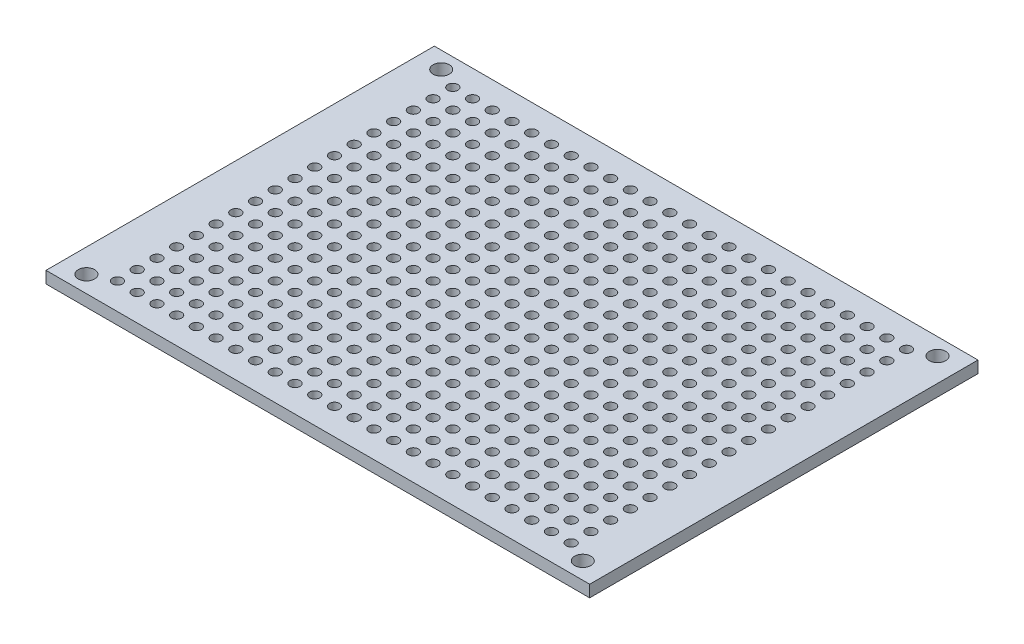
from build123d import *

# Parameters (mm, degrees)
SKETCH1_W                          = 70
SKETCH1_H                          = 50
BOSS_EXTRUDE1_DEPTH                = 0.762
F_1_3_START                        = -0.762
F_1_3_1_3_DIAMETER_HOLE1_OUTLINE_R = 0.65
F_1_3_1_3_DIAMETER_HOLE1_DEPTH     = 1.524
F_2_1_2_1_DIAMETER_HOLE1_D         = 2.1


# Read off the part's stored shape, not the designer's step: Ø1.3 (1.3) Diameter Hole1
with BuildPart() as part:
    # Sketch1 → Boss-Extrude1 (new, symmetric)
    with BuildSketch(Plane(origin=(0, 0, 0), x_dir=(1, 0, 0), z_dir=(0, 1, 0))):
        with Locations((35, 25)):
            Rectangle(SKETCH1_W, SKETCH1_H)
    extrude(amount=BOSS_EXTRUDE1_DEPTH, both=True)

    # Ø1.3 (1.3) Diameter Hole1 outline → Ø1.3 (1.3) Diameter Hole1 (cut)
    with BuildSketch(Plane(origin=(0, 0, 0), x_dir=(1, 0, 0), z_dir=(0, 1, 0)).offset(F_1_3_START)):
        with Locations((5.79, 46.59)):
            Circle(F_1_3_1_3_DIAMETER_HOLE1_OUTLINE_R)
        with Locations((5.79, 44.05)):
            Circle(F_1_3_1_3_DIAMETER_HOLE1_OUTLINE_R)
        with Locations((5.79, 41.51)):
            Circle(F_1_3_1_3_DIAMETER_HOLE1_OUTLINE_R)
        with Locations((5.79, 38.97)):
            Circle(F_1_3_1_3_DIAMETER_HOLE1_OUTLINE_R)
        with Locations((5.79, 36.43)):
            Circle(F_1_3_1_3_DIAMETER_HOLE1_OUTLINE_R)
        with Locations((5.79, 33.89)):
            Circle(F_1_3_1_3_DIAMETER_HOLE1_OUTLINE_R)
        with Locations((5.79, 31.35)):
            Circle(F_1_3_1_3_DIAMETER_HOLE1_OUTLINE_R)
        with Locations((5.79, 28.81)):
            Circle(F_1_3_1_3_DIAMETER_HOLE1_OUTLINE_R)
        with Locations((5.79, 26.27)):
            Circle(F_1_3_1_3_DIAMETER_HOLE1_OUTLINE_R)
        with Locations((5.79, 23.73)):
            Circle(F_1_3_1_3_DIAMETER_HOLE1_OUTLINE_R)
        with Locations((5.79, 21.19)):
            Circle(F_1_3_1_3_DIAMETER_HOLE1_OUTLINE_R)
        with Locations((5.79, 18.65)):
            Circle(F_1_3_1_3_DIAMETER_HOLE1_OUTLINE_R)
        with Locations((5.79, 16.11)):
            Circle(F_1_3_1_3_DIAMETER_HOLE1_OUTLINE_R)
        with Locations((5.79, 13.57)):
            Circle(F_1_3_1_3_DIAMETER_HOLE1_OUTLINE_R)
        with Locations((5.79, 11.03)):
            Circle(F_1_3_1_3_DIAMETER_HOLE1_OUTLINE_R)
        with Locations((5.79, 8.49)):
            Circle(F_1_3_1_3_DIAMETER_HOLE1_OUTLINE_R)
        with Locations((5.79, 5.95)):
            Circle(F_1_3_1_3_DIAMETER_HOLE1_OUTLINE_R)
        with Locations((64.21, 46.59)):
            Circle(F_1_3_1_3_DIAMETER_HOLE1_OUTLINE_R)
        with Locations((61.67, 46.59)):
            Circle(F_1_3_1_3_DIAMETER_HOLE1_OUTLINE_R)
        with Locations((59.13, 46.59)):
            Circle(F_1_3_1_3_DIAMETER_HOLE1_OUTLINE_R)
        with Locations((56.59, 46.59)):
            Circle(F_1_3_1_3_DIAMETER_HOLE1_OUTLINE_R)
        with Locations((54.05, 46.59)):
            Circle(F_1_3_1_3_DIAMETER_HOLE1_OUTLINE_R)
        with Locations((51.51, 46.59)):
            Circle(F_1_3_1_3_DIAMETER_HOLE1_OUTLINE_R)
        with Locations((48.97, 46.59)):
            Circle(F_1_3_1_3_DIAMETER_HOLE1_OUTLINE_R)
        with Locations((46.43, 46.59)):
            Circle(F_1_3_1_3_DIAMETER_HOLE1_OUTLINE_R)
        with Locations((43.89, 46.59)):
            Circle(F_1_3_1_3_DIAMETER_HOLE1_OUTLINE_R)
        with Locations((41.35, 46.59)):
            Circle(F_1_3_1_3_DIAMETER_HOLE1_OUTLINE_R)
        with Locations((38.81, 46.59)):
            Circle(F_1_3_1_3_DIAMETER_HOLE1_OUTLINE_R)
        with Locations((36.27, 46.59)):
            Circle(F_1_3_1_3_DIAMETER_HOLE1_OUTLINE_R)
        with Locations((33.73, 46.59)):
            Circle(F_1_3_1_3_DIAMETER_HOLE1_OUTLINE_R)
        with Locations((31.19, 46.59)):
            Circle(F_1_3_1_3_DIAMETER_HOLE1_OUTLINE_R)
        with Locations((28.65, 46.59)):
            Circle(F_1_3_1_3_DIAMETER_HOLE1_OUTLINE_R)
        with Locations((26.11, 46.59)):
            Circle(F_1_3_1_3_DIAMETER_HOLE1_OUTLINE_R)
        with Locations((23.57, 46.59)):
            Circle(F_1_3_1_3_DIAMETER_HOLE1_OUTLINE_R)
        with Locations((21.03, 46.59)):
            Circle(F_1_3_1_3_DIAMETER_HOLE1_OUTLINE_R)
        with Locations((18.49, 46.59)):
            Circle(F_1_3_1_3_DIAMETER_HOLE1_OUTLINE_R)
        with Locations((15.95, 46.59)):
            Circle(F_1_3_1_3_DIAMETER_HOLE1_OUTLINE_R)
        with Locations((13.41, 46.59)):
            Circle(F_1_3_1_3_DIAMETER_HOLE1_OUTLINE_R)
        with Locations((10.87, 46.59)):
            Circle(F_1_3_1_3_DIAMETER_HOLE1_OUTLINE_R)
        with Locations((8.33, 46.59)):
            Circle(F_1_3_1_3_DIAMETER_HOLE1_OUTLINE_R)
        with Locations((64.21, 44.05)):
            Circle(F_1_3_1_3_DIAMETER_HOLE1_OUTLINE_R)
        with Locations((61.67, 44.05)):
            Circle(F_1_3_1_3_DIAMETER_HOLE1_OUTLINE_R)
        with Locations((59.13, 44.05)):
            Circle(F_1_3_1_3_DIAMETER_HOLE1_OUTLINE_R)
        with Locations((56.59, 44.05)):
            Circle(F_1_3_1_3_DIAMETER_HOLE1_OUTLINE_R)
        with Locations((54.05, 44.05)):
            Circle(F_1_3_1_3_DIAMETER_HOLE1_OUTLINE_R)
        with Locations((51.51, 44.05)):
            Circle(F_1_3_1_3_DIAMETER_HOLE1_OUTLINE_R)
        with Locations((48.97, 44.05)):
            Circle(F_1_3_1_3_DIAMETER_HOLE1_OUTLINE_R)
        with Locations((46.43, 44.05)):
            Circle(F_1_3_1_3_DIAMETER_HOLE1_OUTLINE_R)
        with Locations((43.89, 44.05)):
            Circle(F_1_3_1_3_DIAMETER_HOLE1_OUTLINE_R)
        with Locations((41.35, 44.05)):
            Circle(F_1_3_1_3_DIAMETER_HOLE1_OUTLINE_R)
        with Locations((38.81, 44.05)):
            Circle(F_1_3_1_3_DIAMETER_HOLE1_OUTLINE_R)
        with Locations((36.27, 44.05)):
            Circle(F_1_3_1_3_DIAMETER_HOLE1_OUTLINE_R)
        with Locations((33.73, 44.05)):
            Circle(F_1_3_1_3_DIAMETER_HOLE1_OUTLINE_R)
        with Locations((31.19, 44.05)):
            Circle(F_1_3_1_3_DIAMETER_HOLE1_OUTLINE_R)
        with Locations((28.65, 44.05)):
            Circle(F_1_3_1_3_DIAMETER_HOLE1_OUTLINE_R)
        with Locations((26.11, 44.05)):
            Circle(F_1_3_1_3_DIAMETER_HOLE1_OUTLINE_R)
        with Locations((23.57, 44.05)):
            Circle(F_1_3_1_3_DIAMETER_HOLE1_OUTLINE_R)
        with Locations((21.03, 44.05)):
            Circle(F_1_3_1_3_DIAMETER_HOLE1_OUTLINE_R)
        with Locations((18.49, 44.05)):
            Circle(F_1_3_1_3_DIAMETER_HOLE1_OUTLINE_R)
        with Locations((15.95, 44.05)):
            Circle(F_1_3_1_3_DIAMETER_HOLE1_OUTLINE_R)
        with Locations((13.41, 44.05)):
            Circle(F_1_3_1_3_DIAMETER_HOLE1_OUTLINE_R)
        with Locations((10.87, 44.05)):
            Circle(F_1_3_1_3_DIAMETER_HOLE1_OUTLINE_R)
        with Locations((8.33, 44.05)):
            Circle(F_1_3_1_3_DIAMETER_HOLE1_OUTLINE_R)
        with Locations((64.21, 41.51)):
            Circle(F_1_3_1_3_DIAMETER_HOLE1_OUTLINE_R)
        with Locations((61.67, 41.51)):
            Circle(F_1_3_1_3_DIAMETER_HOLE1_OUTLINE_R)
        with Locations((59.13, 41.51)):
            Circle(F_1_3_1_3_DIAMETER_HOLE1_OUTLINE_R)
        with Locations((56.59, 41.51)):
            Circle(F_1_3_1_3_DIAMETER_HOLE1_OUTLINE_R)
        with Locations((54.05, 41.51)):
            Circle(F_1_3_1_3_DIAMETER_HOLE1_OUTLINE_R)
        with Locations((51.51, 41.51)):
            Circle(F_1_3_1_3_DIAMETER_HOLE1_OUTLINE_R)
        with Locations((48.97, 41.51)):
            Circle(F_1_3_1_3_DIAMETER_HOLE1_OUTLINE_R)
        with Locations((46.43, 41.51)):
            Circle(F_1_3_1_3_DIAMETER_HOLE1_OUTLINE_R)
        with Locations((43.89, 41.51)):
            Circle(F_1_3_1_3_DIAMETER_HOLE1_OUTLINE_R)
        with Locations((41.35, 41.51)):
            Circle(F_1_3_1_3_DIAMETER_HOLE1_OUTLINE_R)
        with Locations((38.81, 41.51)):
            Circle(F_1_3_1_3_DIAMETER_HOLE1_OUTLINE_R)
        with Locations((36.27, 41.51)):
            Circle(F_1_3_1_3_DIAMETER_HOLE1_OUTLINE_R)
        with Locations((33.73, 41.51)):
            Circle(F_1_3_1_3_DIAMETER_HOLE1_OUTLINE_R)
        with Locations((31.19, 41.51)):
            Circle(F_1_3_1_3_DIAMETER_HOLE1_OUTLINE_R)
        with Locations((28.65, 41.51)):
            Circle(F_1_3_1_3_DIAMETER_HOLE1_OUTLINE_R)
        with Locations((26.11, 41.51)):
            Circle(F_1_3_1_3_DIAMETER_HOLE1_OUTLINE_R)
        with Locations((23.57, 41.51)):
            Circle(F_1_3_1_3_DIAMETER_HOLE1_OUTLINE_R)
        with Locations((21.03, 41.51)):
            Circle(F_1_3_1_3_DIAMETER_HOLE1_OUTLINE_R)
        with Locations((18.49, 41.51)):
            Circle(F_1_3_1_3_DIAMETER_HOLE1_OUTLINE_R)
        with Locations((15.95, 41.51)):
            Circle(F_1_3_1_3_DIAMETER_HOLE1_OUTLINE_R)
        with Locations((13.41, 41.51)):
            Circle(F_1_3_1_3_DIAMETER_HOLE1_OUTLINE_R)
        with Locations((10.87, 41.51)):
            Circle(F_1_3_1_3_DIAMETER_HOLE1_OUTLINE_R)
        with Locations((8.33, 41.51)):
            Circle(F_1_3_1_3_DIAMETER_HOLE1_OUTLINE_R)
        with Locations((64.21, 38.97)):
            Circle(F_1_3_1_3_DIAMETER_HOLE1_OUTLINE_R)
        with Locations((61.67, 38.97)):
            Circle(F_1_3_1_3_DIAMETER_HOLE1_OUTLINE_R)
        with Locations((59.13, 38.97)):
            Circle(F_1_3_1_3_DIAMETER_HOLE1_OUTLINE_R)
        with Locations((56.59, 38.97)):
            Circle(F_1_3_1_3_DIAMETER_HOLE1_OUTLINE_R)
        with Locations((54.05, 38.97)):
            Circle(F_1_3_1_3_DIAMETER_HOLE1_OUTLINE_R)
        with Locations((51.51, 38.97)):
            Circle(F_1_3_1_3_DIAMETER_HOLE1_OUTLINE_R)
        with Locations((48.97, 38.97)):
            Circle(F_1_3_1_3_DIAMETER_HOLE1_OUTLINE_R)
        with Locations((46.43, 38.97)):
            Circle(F_1_3_1_3_DIAMETER_HOLE1_OUTLINE_R)
        with Locations((43.89, 38.97)):
            Circle(F_1_3_1_3_DIAMETER_HOLE1_OUTLINE_R)
        with Locations((41.35, 38.97)):
            Circle(F_1_3_1_3_DIAMETER_HOLE1_OUTLINE_R)
        with Locations((38.81, 38.97)):
            Circle(F_1_3_1_3_DIAMETER_HOLE1_OUTLINE_R)
        with Locations((36.27, 38.97)):
            Circle(F_1_3_1_3_DIAMETER_HOLE1_OUTLINE_R)
        with Locations((33.73, 38.97)):
            Circle(F_1_3_1_3_DIAMETER_HOLE1_OUTLINE_R)
        with Locations((31.19, 38.97)):
            Circle(F_1_3_1_3_DIAMETER_HOLE1_OUTLINE_R)
        with Locations((28.65, 38.97)):
            Circle(F_1_3_1_3_DIAMETER_HOLE1_OUTLINE_R)
        with Locations((26.11, 38.97)):
            Circle(F_1_3_1_3_DIAMETER_HOLE1_OUTLINE_R)
        with Locations((23.57, 38.97)):
            Circle(F_1_3_1_3_DIAMETER_HOLE1_OUTLINE_R)
        with Locations((21.03, 38.97)):
            Circle(F_1_3_1_3_DIAMETER_HOLE1_OUTLINE_R)
        with Locations((18.49, 38.97)):
            Circle(F_1_3_1_3_DIAMETER_HOLE1_OUTLINE_R)
        with Locations((15.95, 38.97)):
            Circle(F_1_3_1_3_DIAMETER_HOLE1_OUTLINE_R)
        with Locations((13.41, 38.97)):
            Circle(F_1_3_1_3_DIAMETER_HOLE1_OUTLINE_R)
        with Locations((10.87, 38.97)):
            Circle(F_1_3_1_3_DIAMETER_HOLE1_OUTLINE_R)
        with Locations((8.33, 38.97)):
            Circle(F_1_3_1_3_DIAMETER_HOLE1_OUTLINE_R)
        with Locations((64.21, 36.43)):
            Circle(F_1_3_1_3_DIAMETER_HOLE1_OUTLINE_R)
        with Locations((61.67, 36.43)):
            Circle(F_1_3_1_3_DIAMETER_HOLE1_OUTLINE_R)
        with Locations((59.13, 36.43)):
            Circle(F_1_3_1_3_DIAMETER_HOLE1_OUTLINE_R)
        with Locations((56.59, 36.43)):
            Circle(F_1_3_1_3_DIAMETER_HOLE1_OUTLINE_R)
        with Locations((54.05, 36.43)):
            Circle(F_1_3_1_3_DIAMETER_HOLE1_OUTLINE_R)
        with Locations((51.51, 36.43)):
            Circle(F_1_3_1_3_DIAMETER_HOLE1_OUTLINE_R)
        with Locations((48.97, 36.43)):
            Circle(F_1_3_1_3_DIAMETER_HOLE1_OUTLINE_R)
        with Locations((46.43, 36.43)):
            Circle(F_1_3_1_3_DIAMETER_HOLE1_OUTLINE_R)
        with Locations((43.89, 36.43)):
            Circle(F_1_3_1_3_DIAMETER_HOLE1_OUTLINE_R)
        with Locations((41.35, 36.43)):
            Circle(F_1_3_1_3_DIAMETER_HOLE1_OUTLINE_R)
        with Locations((38.81, 36.43)):
            Circle(F_1_3_1_3_DIAMETER_HOLE1_OUTLINE_R)
        with Locations((36.27, 36.43)):
            Circle(F_1_3_1_3_DIAMETER_HOLE1_OUTLINE_R)
        with Locations((33.73, 36.43)):
            Circle(F_1_3_1_3_DIAMETER_HOLE1_OUTLINE_R)
        with Locations((31.19, 36.43)):
            Circle(F_1_3_1_3_DIAMETER_HOLE1_OUTLINE_R)
        with Locations((28.65, 36.43)):
            Circle(F_1_3_1_3_DIAMETER_HOLE1_OUTLINE_R)
        with Locations((26.11, 36.43)):
            Circle(F_1_3_1_3_DIAMETER_HOLE1_OUTLINE_R)
        with Locations((23.57, 36.43)):
            Circle(F_1_3_1_3_DIAMETER_HOLE1_OUTLINE_R)
        with Locations((21.03, 36.43)):
            Circle(F_1_3_1_3_DIAMETER_HOLE1_OUTLINE_R)
        with Locations((18.49, 36.43)):
            Circle(F_1_3_1_3_DIAMETER_HOLE1_OUTLINE_R)
        with Locations((15.95, 36.43)):
            Circle(F_1_3_1_3_DIAMETER_HOLE1_OUTLINE_R)
        with Locations((13.41, 36.43)):
            Circle(F_1_3_1_3_DIAMETER_HOLE1_OUTLINE_R)
        with Locations((10.87, 36.43)):
            Circle(F_1_3_1_3_DIAMETER_HOLE1_OUTLINE_R)
        with Locations((8.33, 36.43)):
            Circle(F_1_3_1_3_DIAMETER_HOLE1_OUTLINE_R)
        with Locations((64.21, 33.89)):
            Circle(F_1_3_1_3_DIAMETER_HOLE1_OUTLINE_R)
        with Locations((61.67, 33.89)):
            Circle(F_1_3_1_3_DIAMETER_HOLE1_OUTLINE_R)
        with Locations((59.13, 33.89)):
            Circle(F_1_3_1_3_DIAMETER_HOLE1_OUTLINE_R)
        with Locations((56.59, 33.89)):
            Circle(F_1_3_1_3_DIAMETER_HOLE1_OUTLINE_R)
        with Locations((54.05, 33.89)):
            Circle(F_1_3_1_3_DIAMETER_HOLE1_OUTLINE_R)
        with Locations((51.51, 33.89)):
            Circle(F_1_3_1_3_DIAMETER_HOLE1_OUTLINE_R)
        with Locations((48.97, 33.89)):
            Circle(F_1_3_1_3_DIAMETER_HOLE1_OUTLINE_R)
        with Locations((46.43, 33.89)):
            Circle(F_1_3_1_3_DIAMETER_HOLE1_OUTLINE_R)
        with Locations((43.89, 33.89)):
            Circle(F_1_3_1_3_DIAMETER_HOLE1_OUTLINE_R)
        with Locations((41.35, 33.89)):
            Circle(F_1_3_1_3_DIAMETER_HOLE1_OUTLINE_R)
        with Locations((38.81, 33.89)):
            Circle(F_1_3_1_3_DIAMETER_HOLE1_OUTLINE_R)
        with Locations((36.27, 33.89)):
            Circle(F_1_3_1_3_DIAMETER_HOLE1_OUTLINE_R)
        with Locations((33.73, 33.89)):
            Circle(F_1_3_1_3_DIAMETER_HOLE1_OUTLINE_R)
        with Locations((31.19, 33.89)):
            Circle(F_1_3_1_3_DIAMETER_HOLE1_OUTLINE_R)
        with Locations((28.65, 33.89)):
            Circle(F_1_3_1_3_DIAMETER_HOLE1_OUTLINE_R)
        with Locations((26.11, 33.89)):
            Circle(F_1_3_1_3_DIAMETER_HOLE1_OUTLINE_R)
        with Locations((23.57, 33.89)):
            Circle(F_1_3_1_3_DIAMETER_HOLE1_OUTLINE_R)
        with Locations((21.03, 33.89)):
            Circle(F_1_3_1_3_DIAMETER_HOLE1_OUTLINE_R)
        with Locations((18.49, 33.89)):
            Circle(F_1_3_1_3_DIAMETER_HOLE1_OUTLINE_R)
        with Locations((15.95, 33.89)):
            Circle(F_1_3_1_3_DIAMETER_HOLE1_OUTLINE_R)
        with Locations((13.41, 33.89)):
            Circle(F_1_3_1_3_DIAMETER_HOLE1_OUTLINE_R)
        with Locations((10.87, 33.89)):
            Circle(F_1_3_1_3_DIAMETER_HOLE1_OUTLINE_R)
        with Locations((8.33, 33.89)):
            Circle(F_1_3_1_3_DIAMETER_HOLE1_OUTLINE_R)
        with Locations((64.21, 31.35)):
            Circle(F_1_3_1_3_DIAMETER_HOLE1_OUTLINE_R)
        with Locations((61.67, 31.35)):
            Circle(F_1_3_1_3_DIAMETER_HOLE1_OUTLINE_R)
        with Locations((59.13, 31.35)):
            Circle(F_1_3_1_3_DIAMETER_HOLE1_OUTLINE_R)
        with Locations((56.59, 31.35)):
            Circle(F_1_3_1_3_DIAMETER_HOLE1_OUTLINE_R)
        with Locations((54.05, 31.35)):
            Circle(F_1_3_1_3_DIAMETER_HOLE1_OUTLINE_R)
        with Locations((51.51, 31.35)):
            Circle(F_1_3_1_3_DIAMETER_HOLE1_OUTLINE_R)
        with Locations((48.97, 31.35)):
            Circle(F_1_3_1_3_DIAMETER_HOLE1_OUTLINE_R)
        with Locations((46.43, 31.35)):
            Circle(F_1_3_1_3_DIAMETER_HOLE1_OUTLINE_R)
        with Locations((43.89, 31.35)):
            Circle(F_1_3_1_3_DIAMETER_HOLE1_OUTLINE_R)
        with Locations((41.35, 31.35)):
            Circle(F_1_3_1_3_DIAMETER_HOLE1_OUTLINE_R)
        with Locations((38.81, 31.35)):
            Circle(F_1_3_1_3_DIAMETER_HOLE1_OUTLINE_R)
        with Locations((36.27, 31.35)):
            Circle(F_1_3_1_3_DIAMETER_HOLE1_OUTLINE_R)
        with Locations((33.73, 31.35)):
            Circle(F_1_3_1_3_DIAMETER_HOLE1_OUTLINE_R)
        with Locations((31.19, 31.35)):
            Circle(F_1_3_1_3_DIAMETER_HOLE1_OUTLINE_R)
        with Locations((28.65, 31.35)):
            Circle(F_1_3_1_3_DIAMETER_HOLE1_OUTLINE_R)
        with Locations((26.11, 31.35)):
            Circle(F_1_3_1_3_DIAMETER_HOLE1_OUTLINE_R)
        with Locations((23.57, 31.35)):
            Circle(F_1_3_1_3_DIAMETER_HOLE1_OUTLINE_R)
        with Locations((21.03, 31.35)):
            Circle(F_1_3_1_3_DIAMETER_HOLE1_OUTLINE_R)
        with Locations((18.49, 31.35)):
            Circle(F_1_3_1_3_DIAMETER_HOLE1_OUTLINE_R)
        with Locations((15.95, 31.35)):
            Circle(F_1_3_1_3_DIAMETER_HOLE1_OUTLINE_R)
        with Locations((13.41, 31.35)):
            Circle(F_1_3_1_3_DIAMETER_HOLE1_OUTLINE_R)
        with Locations((10.87, 31.35)):
            Circle(F_1_3_1_3_DIAMETER_HOLE1_OUTLINE_R)
        with Locations((8.33, 31.35)):
            Circle(F_1_3_1_3_DIAMETER_HOLE1_OUTLINE_R)
        with Locations((64.21, 28.81)):
            Circle(F_1_3_1_3_DIAMETER_HOLE1_OUTLINE_R)
        with Locations((61.67, 28.81)):
            Circle(F_1_3_1_3_DIAMETER_HOLE1_OUTLINE_R)
        with Locations((59.13, 28.81)):
            Circle(F_1_3_1_3_DIAMETER_HOLE1_OUTLINE_R)
        with Locations((56.59, 28.81)):
            Circle(F_1_3_1_3_DIAMETER_HOLE1_OUTLINE_R)
        with Locations((54.05, 28.81)):
            Circle(F_1_3_1_3_DIAMETER_HOLE1_OUTLINE_R)
        with Locations((51.51, 28.81)):
            Circle(F_1_3_1_3_DIAMETER_HOLE1_OUTLINE_R)
        with Locations((48.97, 28.81)):
            Circle(F_1_3_1_3_DIAMETER_HOLE1_OUTLINE_R)
        with Locations((46.43, 28.81)):
            Circle(F_1_3_1_3_DIAMETER_HOLE1_OUTLINE_R)
        with Locations((43.89, 28.81)):
            Circle(F_1_3_1_3_DIAMETER_HOLE1_OUTLINE_R)
        with Locations((41.35, 28.81)):
            Circle(F_1_3_1_3_DIAMETER_HOLE1_OUTLINE_R)
        with Locations((38.81, 28.81)):
            Circle(F_1_3_1_3_DIAMETER_HOLE1_OUTLINE_R)
        with Locations((36.27, 28.81)):
            Circle(F_1_3_1_3_DIAMETER_HOLE1_OUTLINE_R)
        with Locations((33.73, 28.81)):
            Circle(F_1_3_1_3_DIAMETER_HOLE1_OUTLINE_R)
        with Locations((31.19, 28.81)):
            Circle(F_1_3_1_3_DIAMETER_HOLE1_OUTLINE_R)
        with Locations((28.65, 28.81)):
            Circle(F_1_3_1_3_DIAMETER_HOLE1_OUTLINE_R)
        with Locations((26.11, 28.81)):
            Circle(F_1_3_1_3_DIAMETER_HOLE1_OUTLINE_R)
        with Locations((23.57, 28.81)):
            Circle(F_1_3_1_3_DIAMETER_HOLE1_OUTLINE_R)
        with Locations((21.03, 28.81)):
            Circle(F_1_3_1_3_DIAMETER_HOLE1_OUTLINE_R)
        with Locations((18.49, 28.81)):
            Circle(F_1_3_1_3_DIAMETER_HOLE1_OUTLINE_R)
        with Locations((15.95, 28.81)):
            Circle(F_1_3_1_3_DIAMETER_HOLE1_OUTLINE_R)
        with Locations((13.41, 28.81)):
            Circle(F_1_3_1_3_DIAMETER_HOLE1_OUTLINE_R)
        with Locations((10.87, 28.81)):
            Circle(F_1_3_1_3_DIAMETER_HOLE1_OUTLINE_R)
        with Locations((8.33, 28.81)):
            Circle(F_1_3_1_3_DIAMETER_HOLE1_OUTLINE_R)
        with Locations((64.21, 26.27)):
            Circle(F_1_3_1_3_DIAMETER_HOLE1_OUTLINE_R)
        with Locations((61.67, 26.27)):
            Circle(F_1_3_1_3_DIAMETER_HOLE1_OUTLINE_R)
        with Locations((59.13, 26.27)):
            Circle(F_1_3_1_3_DIAMETER_HOLE1_OUTLINE_R)
        with Locations((56.59, 26.27)):
            Circle(F_1_3_1_3_DIAMETER_HOLE1_OUTLINE_R)
        with Locations((54.05, 26.27)):
            Circle(F_1_3_1_3_DIAMETER_HOLE1_OUTLINE_R)
        with Locations((51.51, 26.27)):
            Circle(F_1_3_1_3_DIAMETER_HOLE1_OUTLINE_R)
        with Locations((48.97, 26.27)):
            Circle(F_1_3_1_3_DIAMETER_HOLE1_OUTLINE_R)
        with Locations((46.43, 26.27)):
            Circle(F_1_3_1_3_DIAMETER_HOLE1_OUTLINE_R)
        with Locations((43.89, 26.27)):
            Circle(F_1_3_1_3_DIAMETER_HOLE1_OUTLINE_R)
        with Locations((41.35, 26.27)):
            Circle(F_1_3_1_3_DIAMETER_HOLE1_OUTLINE_R)
        with Locations((38.81, 26.27)):
            Circle(F_1_3_1_3_DIAMETER_HOLE1_OUTLINE_R)
        with Locations((36.27, 26.27)):
            Circle(F_1_3_1_3_DIAMETER_HOLE1_OUTLINE_R)
        with Locations((33.73, 26.27)):
            Circle(F_1_3_1_3_DIAMETER_HOLE1_OUTLINE_R)
        with Locations((31.19, 26.27)):
            Circle(F_1_3_1_3_DIAMETER_HOLE1_OUTLINE_R)
        with Locations((28.65, 26.27)):
            Circle(F_1_3_1_3_DIAMETER_HOLE1_OUTLINE_R)
        with Locations((26.11, 26.27)):
            Circle(F_1_3_1_3_DIAMETER_HOLE1_OUTLINE_R)
        with Locations((23.57, 26.27)):
            Circle(F_1_3_1_3_DIAMETER_HOLE1_OUTLINE_R)
        with Locations((21.03, 26.27)):
            Circle(F_1_3_1_3_DIAMETER_HOLE1_OUTLINE_R)
        with Locations((18.49, 26.27)):
            Circle(F_1_3_1_3_DIAMETER_HOLE1_OUTLINE_R)
        with Locations((15.95, 26.27)):
            Circle(F_1_3_1_3_DIAMETER_HOLE1_OUTLINE_R)
        with Locations((13.41, 26.27)):
            Circle(F_1_3_1_3_DIAMETER_HOLE1_OUTLINE_R)
        with Locations((10.87, 26.27)):
            Circle(F_1_3_1_3_DIAMETER_HOLE1_OUTLINE_R)
        with Locations((8.33, 26.27)):
            Circle(F_1_3_1_3_DIAMETER_HOLE1_OUTLINE_R)
        with Locations((64.21, 23.73)):
            Circle(F_1_3_1_3_DIAMETER_HOLE1_OUTLINE_R)
        with Locations((61.67, 23.73)):
            Circle(F_1_3_1_3_DIAMETER_HOLE1_OUTLINE_R)
        with Locations((59.13, 23.73)):
            Circle(F_1_3_1_3_DIAMETER_HOLE1_OUTLINE_R)
        with Locations((56.59, 23.73)):
            Circle(F_1_3_1_3_DIAMETER_HOLE1_OUTLINE_R)
        with Locations((54.05, 23.73)):
            Circle(F_1_3_1_3_DIAMETER_HOLE1_OUTLINE_R)
        with Locations((51.51, 23.73)):
            Circle(F_1_3_1_3_DIAMETER_HOLE1_OUTLINE_R)
        with Locations((48.97, 23.73)):
            Circle(F_1_3_1_3_DIAMETER_HOLE1_OUTLINE_R)
        with Locations((46.43, 23.73)):
            Circle(F_1_3_1_3_DIAMETER_HOLE1_OUTLINE_R)
        with Locations((43.89, 23.73)):
            Circle(F_1_3_1_3_DIAMETER_HOLE1_OUTLINE_R)
        with Locations((41.35, 23.73)):
            Circle(F_1_3_1_3_DIAMETER_HOLE1_OUTLINE_R)
        with Locations((38.81, 23.73)):
            Circle(F_1_3_1_3_DIAMETER_HOLE1_OUTLINE_R)
        with Locations((36.27, 23.73)):
            Circle(F_1_3_1_3_DIAMETER_HOLE1_OUTLINE_R)
        with Locations((33.73, 23.73)):
            Circle(F_1_3_1_3_DIAMETER_HOLE1_OUTLINE_R)
        with Locations((31.19, 23.73)):
            Circle(F_1_3_1_3_DIAMETER_HOLE1_OUTLINE_R)
        with Locations((28.65, 23.73)):
            Circle(F_1_3_1_3_DIAMETER_HOLE1_OUTLINE_R)
        with Locations((26.11, 23.73)):
            Circle(F_1_3_1_3_DIAMETER_HOLE1_OUTLINE_R)
        with Locations((23.57, 23.73)):
            Circle(F_1_3_1_3_DIAMETER_HOLE1_OUTLINE_R)
        with Locations((21.03, 23.73)):
            Circle(F_1_3_1_3_DIAMETER_HOLE1_OUTLINE_R)
        with Locations((18.49, 23.73)):
            Circle(F_1_3_1_3_DIAMETER_HOLE1_OUTLINE_R)
        with Locations((15.95, 23.73)):
            Circle(F_1_3_1_3_DIAMETER_HOLE1_OUTLINE_R)
        with Locations((13.41, 23.73)):
            Circle(F_1_3_1_3_DIAMETER_HOLE1_OUTLINE_R)
        with Locations((10.87, 23.73)):
            Circle(F_1_3_1_3_DIAMETER_HOLE1_OUTLINE_R)
        with Locations((8.33, 23.73)):
            Circle(F_1_3_1_3_DIAMETER_HOLE1_OUTLINE_R)
        with Locations((64.21, 21.19)):
            Circle(F_1_3_1_3_DIAMETER_HOLE1_OUTLINE_R)
        with Locations((61.67, 21.19)):
            Circle(F_1_3_1_3_DIAMETER_HOLE1_OUTLINE_R)
        with Locations((59.13, 21.19)):
            Circle(F_1_3_1_3_DIAMETER_HOLE1_OUTLINE_R)
        with Locations((56.59, 21.19)):
            Circle(F_1_3_1_3_DIAMETER_HOLE1_OUTLINE_R)
        with Locations((54.05, 21.19)):
            Circle(F_1_3_1_3_DIAMETER_HOLE1_OUTLINE_R)
        with Locations((51.51, 21.19)):
            Circle(F_1_3_1_3_DIAMETER_HOLE1_OUTLINE_R)
        with Locations((48.97, 21.19)):
            Circle(F_1_3_1_3_DIAMETER_HOLE1_OUTLINE_R)
        with Locations((46.43, 21.19)):
            Circle(F_1_3_1_3_DIAMETER_HOLE1_OUTLINE_R)
        with Locations((43.89, 21.19)):
            Circle(F_1_3_1_3_DIAMETER_HOLE1_OUTLINE_R)
        with Locations((41.35, 21.19)):
            Circle(F_1_3_1_3_DIAMETER_HOLE1_OUTLINE_R)
        with Locations((38.81, 21.19)):
            Circle(F_1_3_1_3_DIAMETER_HOLE1_OUTLINE_R)
        with Locations((36.27, 21.19)):
            Circle(F_1_3_1_3_DIAMETER_HOLE1_OUTLINE_R)
        with Locations((33.73, 21.19)):
            Circle(F_1_3_1_3_DIAMETER_HOLE1_OUTLINE_R)
        with Locations((31.19, 21.19)):
            Circle(F_1_3_1_3_DIAMETER_HOLE1_OUTLINE_R)
        with Locations((28.65, 21.19)):
            Circle(F_1_3_1_3_DIAMETER_HOLE1_OUTLINE_R)
        with Locations((26.11, 21.19)):
            Circle(F_1_3_1_3_DIAMETER_HOLE1_OUTLINE_R)
        with Locations((23.57, 21.19)):
            Circle(F_1_3_1_3_DIAMETER_HOLE1_OUTLINE_R)
        with Locations((21.03, 21.19)):
            Circle(F_1_3_1_3_DIAMETER_HOLE1_OUTLINE_R)
        with Locations((18.49, 21.19)):
            Circle(F_1_3_1_3_DIAMETER_HOLE1_OUTLINE_R)
        with Locations((15.95, 21.19)):
            Circle(F_1_3_1_3_DIAMETER_HOLE1_OUTLINE_R)
        with Locations((13.41, 21.19)):
            Circle(F_1_3_1_3_DIAMETER_HOLE1_OUTLINE_R)
        with Locations((10.87, 21.19)):
            Circle(F_1_3_1_3_DIAMETER_HOLE1_OUTLINE_R)
        with Locations((8.33, 21.19)):
            Circle(F_1_3_1_3_DIAMETER_HOLE1_OUTLINE_R)
        with Locations((64.21, 18.65)):
            Circle(F_1_3_1_3_DIAMETER_HOLE1_OUTLINE_R)
        with Locations((61.67, 18.65)):
            Circle(F_1_3_1_3_DIAMETER_HOLE1_OUTLINE_R)
        with Locations((59.13, 18.65)):
            Circle(F_1_3_1_3_DIAMETER_HOLE1_OUTLINE_R)
        with Locations((56.59, 18.65)):
            Circle(F_1_3_1_3_DIAMETER_HOLE1_OUTLINE_R)
        with Locations((54.05, 18.65)):
            Circle(F_1_3_1_3_DIAMETER_HOLE1_OUTLINE_R)
        with Locations((51.51, 18.65)):
            Circle(F_1_3_1_3_DIAMETER_HOLE1_OUTLINE_R)
        with Locations((48.97, 18.65)):
            Circle(F_1_3_1_3_DIAMETER_HOLE1_OUTLINE_R)
        with Locations((46.43, 18.65)):
            Circle(F_1_3_1_3_DIAMETER_HOLE1_OUTLINE_R)
        with Locations((43.89, 18.65)):
            Circle(F_1_3_1_3_DIAMETER_HOLE1_OUTLINE_R)
        with Locations((41.35, 18.65)):
            Circle(F_1_3_1_3_DIAMETER_HOLE1_OUTLINE_R)
        with Locations((38.81, 18.65)):
            Circle(F_1_3_1_3_DIAMETER_HOLE1_OUTLINE_R)
        with Locations((36.27, 18.65)):
            Circle(F_1_3_1_3_DIAMETER_HOLE1_OUTLINE_R)
        with Locations((33.73, 18.65)):
            Circle(F_1_3_1_3_DIAMETER_HOLE1_OUTLINE_R)
        with Locations((31.19, 18.65)):
            Circle(F_1_3_1_3_DIAMETER_HOLE1_OUTLINE_R)
        with Locations((28.65, 18.65)):
            Circle(F_1_3_1_3_DIAMETER_HOLE1_OUTLINE_R)
        with Locations((26.11, 18.65)):
            Circle(F_1_3_1_3_DIAMETER_HOLE1_OUTLINE_R)
        with Locations((23.57, 18.65)):
            Circle(F_1_3_1_3_DIAMETER_HOLE1_OUTLINE_R)
        with Locations((21.03, 18.65)):
            Circle(F_1_3_1_3_DIAMETER_HOLE1_OUTLINE_R)
        with Locations((18.49, 18.65)):
            Circle(F_1_3_1_3_DIAMETER_HOLE1_OUTLINE_R)
        with Locations((15.95, 18.65)):
            Circle(F_1_3_1_3_DIAMETER_HOLE1_OUTLINE_R)
        with Locations((13.41, 18.65)):
            Circle(F_1_3_1_3_DIAMETER_HOLE1_OUTLINE_R)
        with Locations((10.87, 18.65)):
            Circle(F_1_3_1_3_DIAMETER_HOLE1_OUTLINE_R)
        with Locations((8.33, 18.65)):
            Circle(F_1_3_1_3_DIAMETER_HOLE1_OUTLINE_R)
        with Locations((64.21, 16.11)):
            Circle(F_1_3_1_3_DIAMETER_HOLE1_OUTLINE_R)
        with Locations((61.67, 16.11)):
            Circle(F_1_3_1_3_DIAMETER_HOLE1_OUTLINE_R)
        with Locations((59.13, 16.11)):
            Circle(F_1_3_1_3_DIAMETER_HOLE1_OUTLINE_R)
        with Locations((56.59, 16.11)):
            Circle(F_1_3_1_3_DIAMETER_HOLE1_OUTLINE_R)
        with Locations((54.05, 16.11)):
            Circle(F_1_3_1_3_DIAMETER_HOLE1_OUTLINE_R)
        with Locations((51.51, 16.11)):
            Circle(F_1_3_1_3_DIAMETER_HOLE1_OUTLINE_R)
        with Locations((48.97, 16.11)):
            Circle(F_1_3_1_3_DIAMETER_HOLE1_OUTLINE_R)
        with Locations((46.43, 16.11)):
            Circle(F_1_3_1_3_DIAMETER_HOLE1_OUTLINE_R)
        with Locations((43.89, 16.11)):
            Circle(F_1_3_1_3_DIAMETER_HOLE1_OUTLINE_R)
        with Locations((41.35, 16.11)):
            Circle(F_1_3_1_3_DIAMETER_HOLE1_OUTLINE_R)
        with Locations((38.81, 16.11)):
            Circle(F_1_3_1_3_DIAMETER_HOLE1_OUTLINE_R)
        with Locations((36.27, 16.11)):
            Circle(F_1_3_1_3_DIAMETER_HOLE1_OUTLINE_R)
        with Locations((33.73, 16.11)):
            Circle(F_1_3_1_3_DIAMETER_HOLE1_OUTLINE_R)
        with Locations((31.19, 16.11)):
            Circle(F_1_3_1_3_DIAMETER_HOLE1_OUTLINE_R)
        with Locations((28.65, 16.11)):
            Circle(F_1_3_1_3_DIAMETER_HOLE1_OUTLINE_R)
        with Locations((26.11, 16.11)):
            Circle(F_1_3_1_3_DIAMETER_HOLE1_OUTLINE_R)
        with Locations((23.57, 16.11)):
            Circle(F_1_3_1_3_DIAMETER_HOLE1_OUTLINE_R)
        with Locations((21.03, 16.11)):
            Circle(F_1_3_1_3_DIAMETER_HOLE1_OUTLINE_R)
        with Locations((18.49, 16.11)):
            Circle(F_1_3_1_3_DIAMETER_HOLE1_OUTLINE_R)
        with Locations((15.95, 16.11)):
            Circle(F_1_3_1_3_DIAMETER_HOLE1_OUTLINE_R)
        with Locations((13.41, 16.11)):
            Circle(F_1_3_1_3_DIAMETER_HOLE1_OUTLINE_R)
        with Locations((10.87, 16.11)):
            Circle(F_1_3_1_3_DIAMETER_HOLE1_OUTLINE_R)
        with Locations((8.33, 16.11)):
            Circle(F_1_3_1_3_DIAMETER_HOLE1_OUTLINE_R)
        with Locations((64.21, 13.57)):
            Circle(F_1_3_1_3_DIAMETER_HOLE1_OUTLINE_R)
        with Locations((61.67, 13.57)):
            Circle(F_1_3_1_3_DIAMETER_HOLE1_OUTLINE_R)
        with Locations((59.13, 13.57)):
            Circle(F_1_3_1_3_DIAMETER_HOLE1_OUTLINE_R)
        with Locations((56.59, 13.57)):
            Circle(F_1_3_1_3_DIAMETER_HOLE1_OUTLINE_R)
        with Locations((54.05, 13.57)):
            Circle(F_1_3_1_3_DIAMETER_HOLE1_OUTLINE_R)
        with Locations((51.51, 13.57)):
            Circle(F_1_3_1_3_DIAMETER_HOLE1_OUTLINE_R)
        with Locations((48.97, 13.57)):
            Circle(F_1_3_1_3_DIAMETER_HOLE1_OUTLINE_R)
        with Locations((46.43, 13.57)):
            Circle(F_1_3_1_3_DIAMETER_HOLE1_OUTLINE_R)
        with Locations((43.89, 13.57)):
            Circle(F_1_3_1_3_DIAMETER_HOLE1_OUTLINE_R)
        with Locations((41.35, 13.57)):
            Circle(F_1_3_1_3_DIAMETER_HOLE1_OUTLINE_R)
        with Locations((38.81, 13.57)):
            Circle(F_1_3_1_3_DIAMETER_HOLE1_OUTLINE_R)
        with Locations((36.27, 13.57)):
            Circle(F_1_3_1_3_DIAMETER_HOLE1_OUTLINE_R)
        with Locations((33.73, 13.57)):
            Circle(F_1_3_1_3_DIAMETER_HOLE1_OUTLINE_R)
        with Locations((31.19, 13.57)):
            Circle(F_1_3_1_3_DIAMETER_HOLE1_OUTLINE_R)
        with Locations((28.65, 13.57)):
            Circle(F_1_3_1_3_DIAMETER_HOLE1_OUTLINE_R)
        with Locations((26.11, 13.57)):
            Circle(F_1_3_1_3_DIAMETER_HOLE1_OUTLINE_R)
        with Locations((23.57, 13.57)):
            Circle(F_1_3_1_3_DIAMETER_HOLE1_OUTLINE_R)
        with Locations((21.03, 13.57)):
            Circle(F_1_3_1_3_DIAMETER_HOLE1_OUTLINE_R)
        with Locations((18.49, 13.57)):
            Circle(F_1_3_1_3_DIAMETER_HOLE1_OUTLINE_R)
        with Locations((15.95, 13.57)):
            Circle(F_1_3_1_3_DIAMETER_HOLE1_OUTLINE_R)
        with Locations((13.41, 13.57)):
            Circle(F_1_3_1_3_DIAMETER_HOLE1_OUTLINE_R)
        with Locations((10.87, 13.57)):
            Circle(F_1_3_1_3_DIAMETER_HOLE1_OUTLINE_R)
        with Locations((8.33, 13.57)):
            Circle(F_1_3_1_3_DIAMETER_HOLE1_OUTLINE_R)
        with Locations((64.21, 11.03)):
            Circle(F_1_3_1_3_DIAMETER_HOLE1_OUTLINE_R)
        with Locations((61.67, 11.03)):
            Circle(F_1_3_1_3_DIAMETER_HOLE1_OUTLINE_R)
        with Locations((59.13, 11.03)):
            Circle(F_1_3_1_3_DIAMETER_HOLE1_OUTLINE_R)
        with Locations((56.59, 11.03)):
            Circle(F_1_3_1_3_DIAMETER_HOLE1_OUTLINE_R)
        with Locations((54.05, 11.03)):
            Circle(F_1_3_1_3_DIAMETER_HOLE1_OUTLINE_R)
        with Locations((51.51, 11.03)):
            Circle(F_1_3_1_3_DIAMETER_HOLE1_OUTLINE_R)
        with Locations((48.97, 11.03)):
            Circle(F_1_3_1_3_DIAMETER_HOLE1_OUTLINE_R)
        with Locations((46.43, 11.03)):
            Circle(F_1_3_1_3_DIAMETER_HOLE1_OUTLINE_R)
        with Locations((43.89, 11.03)):
            Circle(F_1_3_1_3_DIAMETER_HOLE1_OUTLINE_R)
        with Locations((41.35, 11.03)):
            Circle(F_1_3_1_3_DIAMETER_HOLE1_OUTLINE_R)
        with Locations((38.81, 11.03)):
            Circle(F_1_3_1_3_DIAMETER_HOLE1_OUTLINE_R)
        with Locations((36.27, 11.03)):
            Circle(F_1_3_1_3_DIAMETER_HOLE1_OUTLINE_R)
        with Locations((33.73, 11.03)):
            Circle(F_1_3_1_3_DIAMETER_HOLE1_OUTLINE_R)
        with Locations((31.19, 11.03)):
            Circle(F_1_3_1_3_DIAMETER_HOLE1_OUTLINE_R)
        with Locations((28.65, 11.03)):
            Circle(F_1_3_1_3_DIAMETER_HOLE1_OUTLINE_R)
        with Locations((26.11, 11.03)):
            Circle(F_1_3_1_3_DIAMETER_HOLE1_OUTLINE_R)
        with Locations((23.57, 11.03)):
            Circle(F_1_3_1_3_DIAMETER_HOLE1_OUTLINE_R)
        with Locations((21.03, 11.03)):
            Circle(F_1_3_1_3_DIAMETER_HOLE1_OUTLINE_R)
        with Locations((18.49, 11.03)):
            Circle(F_1_3_1_3_DIAMETER_HOLE1_OUTLINE_R)
        with Locations((15.95, 11.03)):
            Circle(F_1_3_1_3_DIAMETER_HOLE1_OUTLINE_R)
        with Locations((13.41, 11.03)):
            Circle(F_1_3_1_3_DIAMETER_HOLE1_OUTLINE_R)
        with Locations((10.87, 11.03)):
            Circle(F_1_3_1_3_DIAMETER_HOLE1_OUTLINE_R)
        with Locations((8.33, 11.03)):
            Circle(F_1_3_1_3_DIAMETER_HOLE1_OUTLINE_R)
        with Locations((64.21, 8.49)):
            Circle(F_1_3_1_3_DIAMETER_HOLE1_OUTLINE_R)
        with Locations((61.67, 8.49)):
            Circle(F_1_3_1_3_DIAMETER_HOLE1_OUTLINE_R)
        with Locations((59.13, 8.49)):
            Circle(F_1_3_1_3_DIAMETER_HOLE1_OUTLINE_R)
        with Locations((56.59, 8.49)):
            Circle(F_1_3_1_3_DIAMETER_HOLE1_OUTLINE_R)
        with Locations((54.05, 8.49)):
            Circle(F_1_3_1_3_DIAMETER_HOLE1_OUTLINE_R)
        with Locations((51.51, 8.49)):
            Circle(F_1_3_1_3_DIAMETER_HOLE1_OUTLINE_R)
        with Locations((48.97, 8.49)):
            Circle(F_1_3_1_3_DIAMETER_HOLE1_OUTLINE_R)
        with Locations((46.43, 8.49)):
            Circle(F_1_3_1_3_DIAMETER_HOLE1_OUTLINE_R)
        with Locations((43.89, 8.49)):
            Circle(F_1_3_1_3_DIAMETER_HOLE1_OUTLINE_R)
        with Locations((41.35, 8.49)):
            Circle(F_1_3_1_3_DIAMETER_HOLE1_OUTLINE_R)
        with Locations((38.81, 8.49)):
            Circle(F_1_3_1_3_DIAMETER_HOLE1_OUTLINE_R)
        with Locations((36.27, 8.49)):
            Circle(F_1_3_1_3_DIAMETER_HOLE1_OUTLINE_R)
        with Locations((33.73, 8.49)):
            Circle(F_1_3_1_3_DIAMETER_HOLE1_OUTLINE_R)
        with Locations((31.19, 8.49)):
            Circle(F_1_3_1_3_DIAMETER_HOLE1_OUTLINE_R)
        with Locations((28.65, 8.49)):
            Circle(F_1_3_1_3_DIAMETER_HOLE1_OUTLINE_R)
        with Locations((26.11, 8.49)):
            Circle(F_1_3_1_3_DIAMETER_HOLE1_OUTLINE_R)
        with Locations((23.57, 8.49)):
            Circle(F_1_3_1_3_DIAMETER_HOLE1_OUTLINE_R)
        with Locations((21.03, 8.49)):
            Circle(F_1_3_1_3_DIAMETER_HOLE1_OUTLINE_R)
        with Locations((18.49, 8.49)):
            Circle(F_1_3_1_3_DIAMETER_HOLE1_OUTLINE_R)
        with Locations((15.95, 8.49)):
            Circle(F_1_3_1_3_DIAMETER_HOLE1_OUTLINE_R)
        with Locations((13.41, 8.49)):
            Circle(F_1_3_1_3_DIAMETER_HOLE1_OUTLINE_R)
        with Locations((10.87, 8.49)):
            Circle(F_1_3_1_3_DIAMETER_HOLE1_OUTLINE_R)
        with Locations((8.33, 8.49)):
            Circle(F_1_3_1_3_DIAMETER_HOLE1_OUTLINE_R)
        with Locations((64.21, 5.95)):
            Circle(F_1_3_1_3_DIAMETER_HOLE1_OUTLINE_R)
        with Locations((61.67, 5.95)):
            Circle(F_1_3_1_3_DIAMETER_HOLE1_OUTLINE_R)
        with Locations((59.13, 5.95)):
            Circle(F_1_3_1_3_DIAMETER_HOLE1_OUTLINE_R)
        with Locations((56.59, 5.95)):
            Circle(F_1_3_1_3_DIAMETER_HOLE1_OUTLINE_R)
        with Locations((54.05, 5.95)):
            Circle(F_1_3_1_3_DIAMETER_HOLE1_OUTLINE_R)
        with Locations((51.51, 5.95)):
            Circle(F_1_3_1_3_DIAMETER_HOLE1_OUTLINE_R)
        with Locations((48.97, 5.95)):
            Circle(F_1_3_1_3_DIAMETER_HOLE1_OUTLINE_R)
        with Locations((46.43, 5.95)):
            Circle(F_1_3_1_3_DIAMETER_HOLE1_OUTLINE_R)
        with Locations((43.89, 5.95)):
            Circle(F_1_3_1_3_DIAMETER_HOLE1_OUTLINE_R)
        with Locations((41.35, 5.95)):
            Circle(F_1_3_1_3_DIAMETER_HOLE1_OUTLINE_R)
        with Locations((38.81, 5.95)):
            Circle(F_1_3_1_3_DIAMETER_HOLE1_OUTLINE_R)
        with Locations((36.27, 5.95)):
            Circle(F_1_3_1_3_DIAMETER_HOLE1_OUTLINE_R)
        with Locations((33.73, 5.95)):
            Circle(F_1_3_1_3_DIAMETER_HOLE1_OUTLINE_R)
        with Locations((31.19, 5.95)):
            Circle(F_1_3_1_3_DIAMETER_HOLE1_OUTLINE_R)
        with Locations((28.65, 5.95)):
            Circle(F_1_3_1_3_DIAMETER_HOLE1_OUTLINE_R)
        with Locations((26.11, 5.95)):
            Circle(F_1_3_1_3_DIAMETER_HOLE1_OUTLINE_R)
        with Locations((23.57, 5.95)):
            Circle(F_1_3_1_3_DIAMETER_HOLE1_OUTLINE_R)
        with Locations((21.03, 5.95)):
            Circle(F_1_3_1_3_DIAMETER_HOLE1_OUTLINE_R)
        with Locations((18.49, 5.95)):
            Circle(F_1_3_1_3_DIAMETER_HOLE1_OUTLINE_R)
        with Locations((15.95, 5.95)):
            Circle(F_1_3_1_3_DIAMETER_HOLE1_OUTLINE_R)
        with Locations((13.41, 5.95)):
            Circle(F_1_3_1_3_DIAMETER_HOLE1_OUTLINE_R)
        with Locations((10.87, 5.95)):
            Circle(F_1_3_1_3_DIAMETER_HOLE1_OUTLINE_R)
        with Locations((8.33, 5.95)):
            Circle(F_1_3_1_3_DIAMETER_HOLE1_OUTLINE_R)
        with Locations((64.21, 3.41)):
            Circle(F_1_3_1_3_DIAMETER_HOLE1_OUTLINE_R)
        with Locations((61.67, 3.41)):
            Circle(F_1_3_1_3_DIAMETER_HOLE1_OUTLINE_R)
        with Locations((59.13, 3.41)):
            Circle(F_1_3_1_3_DIAMETER_HOLE1_OUTLINE_R)
        with Locations((56.59, 3.41)):
            Circle(F_1_3_1_3_DIAMETER_HOLE1_OUTLINE_R)
        with Locations((54.05, 3.41)):
            Circle(F_1_3_1_3_DIAMETER_HOLE1_OUTLINE_R)
        with Locations((51.51, 3.41)):
            Circle(F_1_3_1_3_DIAMETER_HOLE1_OUTLINE_R)
        with Locations((48.97, 3.41)):
            Circle(F_1_3_1_3_DIAMETER_HOLE1_OUTLINE_R)
        with Locations((46.43, 3.41)):
            Circle(F_1_3_1_3_DIAMETER_HOLE1_OUTLINE_R)
        with Locations((43.89, 3.41)):
            Circle(F_1_3_1_3_DIAMETER_HOLE1_OUTLINE_R)
        with Locations((41.35, 3.41)):
            Circle(F_1_3_1_3_DIAMETER_HOLE1_OUTLINE_R)
        with Locations((38.81, 3.41)):
            Circle(F_1_3_1_3_DIAMETER_HOLE1_OUTLINE_R)
        with Locations((36.27, 3.41)):
            Circle(F_1_3_1_3_DIAMETER_HOLE1_OUTLINE_R)
        with Locations((33.73, 3.41)):
            Circle(F_1_3_1_3_DIAMETER_HOLE1_OUTLINE_R)
        with Locations((31.19, 3.41)):
            Circle(F_1_3_1_3_DIAMETER_HOLE1_OUTLINE_R)
        with Locations((28.65, 3.41)):
            Circle(F_1_3_1_3_DIAMETER_HOLE1_OUTLINE_R)
        with Locations((26.11, 3.41)):
            Circle(F_1_3_1_3_DIAMETER_HOLE1_OUTLINE_R)
        with Locations((23.57, 3.41)):
            Circle(F_1_3_1_3_DIAMETER_HOLE1_OUTLINE_R)
        with Locations((21.03, 3.41)):
            Circle(F_1_3_1_3_DIAMETER_HOLE1_OUTLINE_R)
        with Locations((18.49, 3.41)):
            Circle(F_1_3_1_3_DIAMETER_HOLE1_OUTLINE_R)
        with Locations((15.95, 3.41)):
            Circle(F_1_3_1_3_DIAMETER_HOLE1_OUTLINE_R)
        with Locations((13.41, 3.41)):
            Circle(F_1_3_1_3_DIAMETER_HOLE1_OUTLINE_R)
        with Locations((10.87, 3.41)):
            Circle(F_1_3_1_3_DIAMETER_HOLE1_OUTLINE_R)
        with Locations((8.33, 3.41)):
            Circle(F_1_3_1_3_DIAMETER_HOLE1_OUTLINE_R)
        with Locations((5.79, 3.41)):
            Circle(F_1_3_1_3_DIAMETER_HOLE1_OUTLINE_R)
    extrude(amount=F_1_3_1_3_DIAMETER_HOLE1_DEPTH, mode=Mode.SUBTRACT)

    # Ø2.1 (2.1) Diameter Hole1 (through all)
    with Locations(Plane(origin=(0, 0.762, 0), x_dir=(1, 0, 0), z_dir=(0, 1, 0))):
        with Locations((3.048, 47.841), (66.952, 2.159), (66.952, 47.841), (3.048, 2.159)):
            Hole(F_2_1_2_1_DIAMETER_HOLE1_D / 2)


solid = part.part
